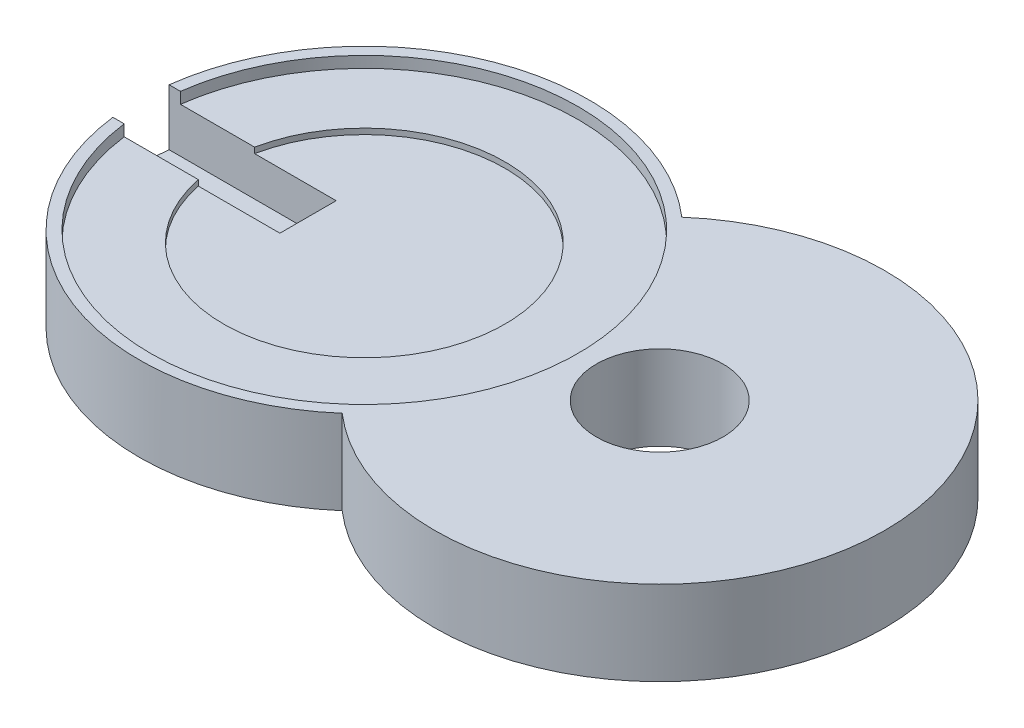
from build123d import *

# Parameters (mm, degrees)
SKETCH_1_R          = 2.25
EXTRUDE_1_DEPTH     = 3
SKETCH_5_R          = 7.6
CUT_EXTRUDE_3_DEPTH = 0.4
SKETCH_6_W          = 9.005100603
SKETCH_6_H          = 2
CUT_EXTRUDE_4_DEPTH = 2
SKETCH_7_R          = 5
CUT_EXTRUDE_5_DEPTH = 0.2


with BuildPart() as part:
    # 草图1 → 凸台-拉伸1 (new body)
    with BuildSketch(Plane(origin=(0, 0, 0), x_dir=(1, 0, 0), z_dir=(0, 1, 0))):
        with BuildLine():
            ThreePointArc((-5.25, -6.036348234), (8, 0), (-5.25, 6.036348234))
            ThreePointArc((-5.25, 6.036348234), (-18.5, 0), (-5.25, -6.036348234))
        make_face()
        Circle(SKETCH_1_R, mode=Mode.SUBTRACT)
    extrude(amount=EXTRUDE_1_DEPTH)

    # 草图5 → 切除-拉伸3 (cut)
    with BuildSketch(Plane(origin=(0, 3, 0), x_dir=(1, 0, 0), z_dir=(0, 1, 0))):
        with Locations((-10.5, 0)):
            Circle(SKETCH_5_R)
    extrude(amount=-CUT_EXTRUDE_3_DEPTH, mode=Mode.SUBTRACT)

    # 草图6 → 切除-拉伸4 (cut)
    with BuildSketch(Plane(origin=(0, 3, 0), x_dir=(1, 0, 0), z_dir=(0, 1, 0))):
        with Locations((-17.002550302, 0)):
            Rectangle(SKETCH_6_W, SKETCH_6_H)
    extrude(amount=-CUT_EXTRUDE_4_DEPTH, mode=Mode.SUBTRACT)

    # 草图7 → 切除-拉伸5 (cut)
    with BuildSketch(Plane(origin=(0, 2.6, 0), x_dir=(1, 0, 0), z_dir=(0, 1, 0))):
        with Locations((-10.5, 0)):
            Circle(SKETCH_7_R)
    extrude(amount=-CUT_EXTRUDE_5_DEPTH, mode=Mode.SUBTRACT)


solid = part.part
